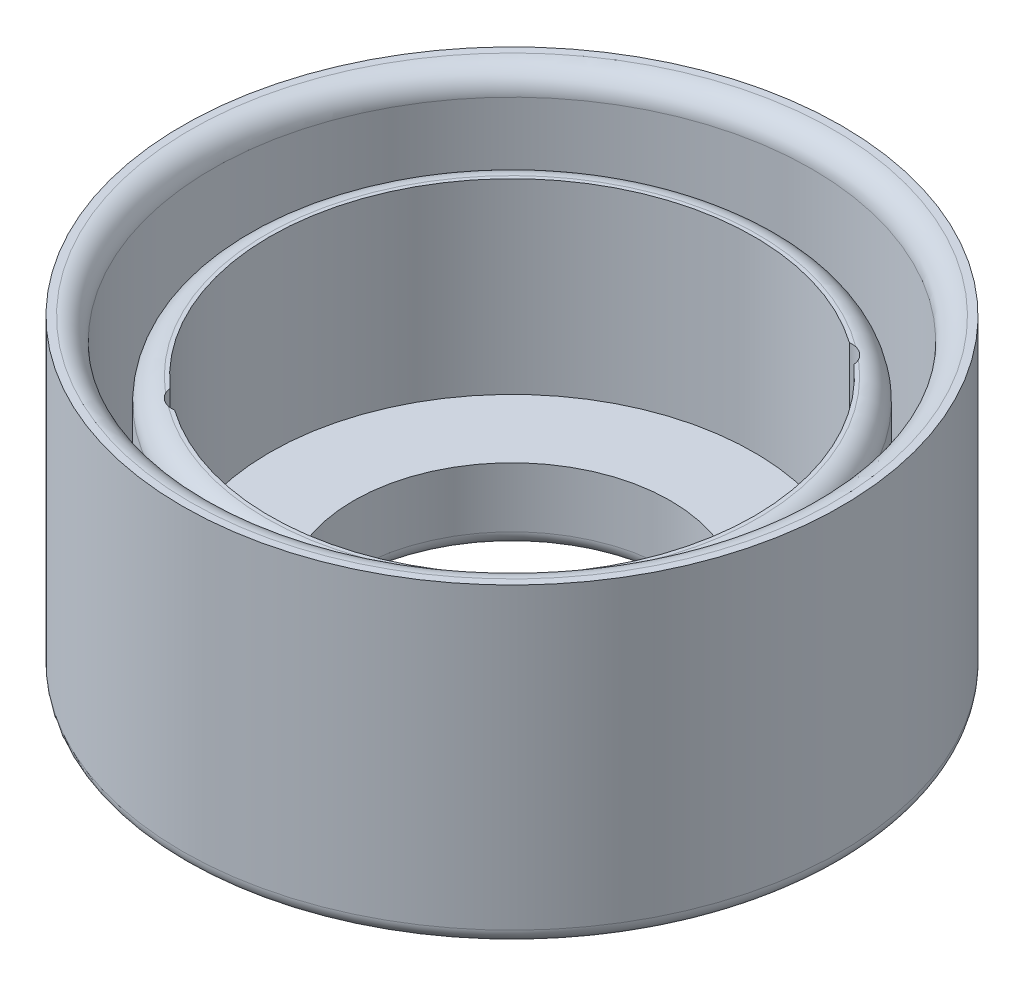
from build123d import *

# Parameters (mm, degrees)
CROQUIS1_R              = 22.05
CROQUIS1_R_2            = 20.05
SALIENTE_EXTRUIR1_DEPTH = 16
CROQUIS1_4_R            = 17.95
CROQUIS1_4_R_2          = 16.2
SALIENTE_EXTRUIR2_DEPTH = 12.5
SALIENTE_EXTRUIR4_START = -5
CROQUIS1_6_R            = 22.05
CROQUIS1_6_R_2          = 20.05
CROQUIS1_6_R_3          = 17.95
CROQUIS1_6_R_4          = 16.2
SALIENTE_EXTRUIR4_DEPTH = 5
CORTAR_EXTRUIR1_REACH   = 39.595
CROQUIS4_R              = 10.6
CROQUIS4_R_2            = 1.25
REDONDEO1_R             = 1
REDONDEO2_R             = 1.5
REDONDEO3_R             = 1


with BuildPart() as part:
    # Croquis1 → Saliente-Extruir1 (new body)
    with BuildSketch(Plane(origin=(0, 0, 0), x_dir=(1, 0, 0), z_dir=(0, 1, 0))):
        with Locations(Location((0, 0, 0), (0, 0, 270))):
            Circle(CROQUIS1_R)
        with Locations(Location((0, 0, 0), (0, 0, 270))):
            Circle(CROQUIS1_R_2, mode=Mode.SUBTRACT)
    extrude(amount=SALIENTE_EXTRUIR1_DEPTH)



with BuildPart() as body_2:
    # Croquis1<4> → Saliente-Extruir2 (new body)
    with BuildSketch(Plane(origin=(0, 0, 0), x_dir=(1, 0, 0), z_dir=(0, 1, 0))):
        with Locations(Location((0, 0, 0), (0, 0, 270))):
            Circle(CROQUIS1_4_R)
        with Locations(Location((0, 0, 0), (0, 0, 270))):
            Circle(CROQUIS1_4_R_2, mode=Mode.SUBTRACT)
    extrude(amount=SALIENTE_EXTRUIR2_DEPTH)


with BuildPart() as part_1:
    add(part.part)

    add(body_2.part)  # Saliente-Extruir4 merges body 2
    # Croquis1<6> → Saliente-Extruir4 (add)
    # profile 1 of 4: a face of its own
    with BuildSketch(Plane(origin=(0, 0, 0), x_dir=(1, 0, 0), z_dir=(0, 1, 0)).offset(SALIENTE_EXTRUIR4_START)):
        with Locations(Location((0, 0, 0), (0, 0, 270))):
            Circle(CROQUIS1_6_R)
        with Locations(Location((0, 0, 0), (0, 0, 270))):
            Circle(CROQUIS1_6_R_2, mode=Mode.SUBTRACT)
    # profile 2 of 4: a face of its own
    with BuildSketch(Plane(origin=(0, 0, 0), x_dir=(1, 0, 0), z_dir=(0, 1, 0)).offset(SALIENTE_EXTRUIR4_START)):
        with Locations(Location((0, 0, 0), (0, 0, 270))):
            Circle(CROQUIS1_6_R_2)
        with Locations(Location((0, 0, 0), (0, 0, 270))):
            Circle(CROQUIS1_6_R_3, mode=Mode.SUBTRACT)
    # profile 3 of 4: a face of its own
    with BuildSketch(Plane(origin=(0, 0, 0), x_dir=(1, 0, 0), z_dir=(0, 1, 0)).offset(SALIENTE_EXTRUIR4_START)):
        with Locations(Location((0, 0, 0), (0, 0, 270))):
            Circle(CROQUIS1_6_R_3)
        with Locations(Location((0, 0, 0), (0, 0, 270))):
            Circle(CROQUIS1_6_R_4, mode=Mode.SUBTRACT)
    # profile 4 of 4: a face of its own
    with BuildSketch(Plane(origin=(0, 0, 0), x_dir=(1, 0, 0), z_dir=(0, 1, 0)).offset(SALIENTE_EXTRUIR4_START)):
        with Locations(Location((0, 0, 0), (0, 0, 270))):
            Circle(CROQUIS1_6_R_4)
    extrude(amount=SALIENTE_EXTRUIR4_DEPTH)

    # Croquis4 → Cortar-Extruir1 (cut, up to next)
    with BuildSketch(Plane.XZ.offset(5), mode=Mode.PRIVATE) as cortar_extruir1_sk1:
        with Locations(Location((0, 0, 0), (0, 0, 270))):
            Circle(CROQUIS4_R)
    cortar_extruir1_tool1 = extrude(cortar_extruir1_sk1.sketch, amount=-CORTAR_EXTRUIR1_REACH, mode=Mode.PRIVATE) & part_1.part
    # Croquis4 → Cortar-Extruir1 (cut, up to next)
    with BuildSketch(Plane.XZ.offset(5), mode=Mode.PRIVATE) as cortar_extruir1_sk2:
        with Locations(Location((-9.5, 12, 0), (0, 0, 270))):
            Circle(CROQUIS4_R_2)
    cortar_extruir1_tool2 = extrude(cortar_extruir1_sk2.sketch, amount=-CORTAR_EXTRUIR1_REACH, mode=Mode.PRIVATE) & part_1.part
    # Croquis4 → Cortar-Extruir1 (cut, up to next)
    with BuildSketch(Plane.XZ.offset(5), mode=Mode.PRIVATE) as cortar_extruir1_sk3:
        with Locations(Location((9.5, -12, 0), (0, 0, 270))):
            Circle(CROQUIS4_R_2)
    cortar_extruir1_tool3 = extrude(cortar_extruir1_sk3.sketch, amount=-CORTAR_EXTRUIR1_REACH, mode=Mode.PRIVATE) & part_1.part
    add(cortar_extruir1_tool1.solids().sort_by_distance((0, -5, 0))[0], mode=Mode.SUBTRACT)
    add(cortar_extruir1_tool2.solids().sort_by_distance((-9.5, -5, 12))[0], mode=Mode.SUBTRACT)
    add(cortar_extruir1_tool3.solids().sort_by_distance((9.5, -5, -12))[0], mode=Mode.SUBTRACT)

    # Redondeo1
    redondeo1_edges = [part_1.edges().sort_by_distance(p)[0] for p in [
        (0, -5, 10.6),
    ]]
    fillet(redondeo1_edges, radius=REDONDEO1_R)

    # Redondeo2
    # the kernel refuses this fillet: 1.5 mm, written as the material it takes off along each edge
    with BuildSketch(Plane(origin=(0, 12.5, 0), x_dir=(0, 0, 1), z_dir=(-1, 0, 0))) as redondeo2_piece_1:
        with BuildLine():
            CenterArc((17.95 - REDONDEO2_R, -REDONDEO2_R), REDONDEO2_R, 0, 90)
            Line((17.95, -REDONDEO2_R), (17.95, 0))
            Line((17.95, 0), (17.95 - REDONDEO2_R, 0))
        make_face()
    revolve(axis=Axis((0, 12.5, 0), (0, 1, 0)), mode=Mode.SUBTRACT)
    with BuildSketch(Plane(origin=(0, 16, 0), x_dir=(0, 0, 1), z_dir=(-1, 0, 0))) as redondeo2_piece_2:
        with BuildLine():
            CenterArc((20.05 + REDONDEO2_R, -REDONDEO2_R), REDONDEO2_R, 90, 90)
            Line((20.05, -REDONDEO2_R), (20.05, 0))
            Line((20.05, 0), (20.05 + REDONDEO2_R, 0))
        make_face()
    revolve(axis=Axis((0, 16, 0), (0, 1, 0)), mode=Mode.SUBTRACT)

    # Redondeo3
    redondeo3_edges = [part_1.edges().sort_by_distance(p)[0] for p in [
        (0, -5, -22.05),
    ]]
    fillet(redondeo3_edges, radius=REDONDEO3_R)


solid = part_1.part
